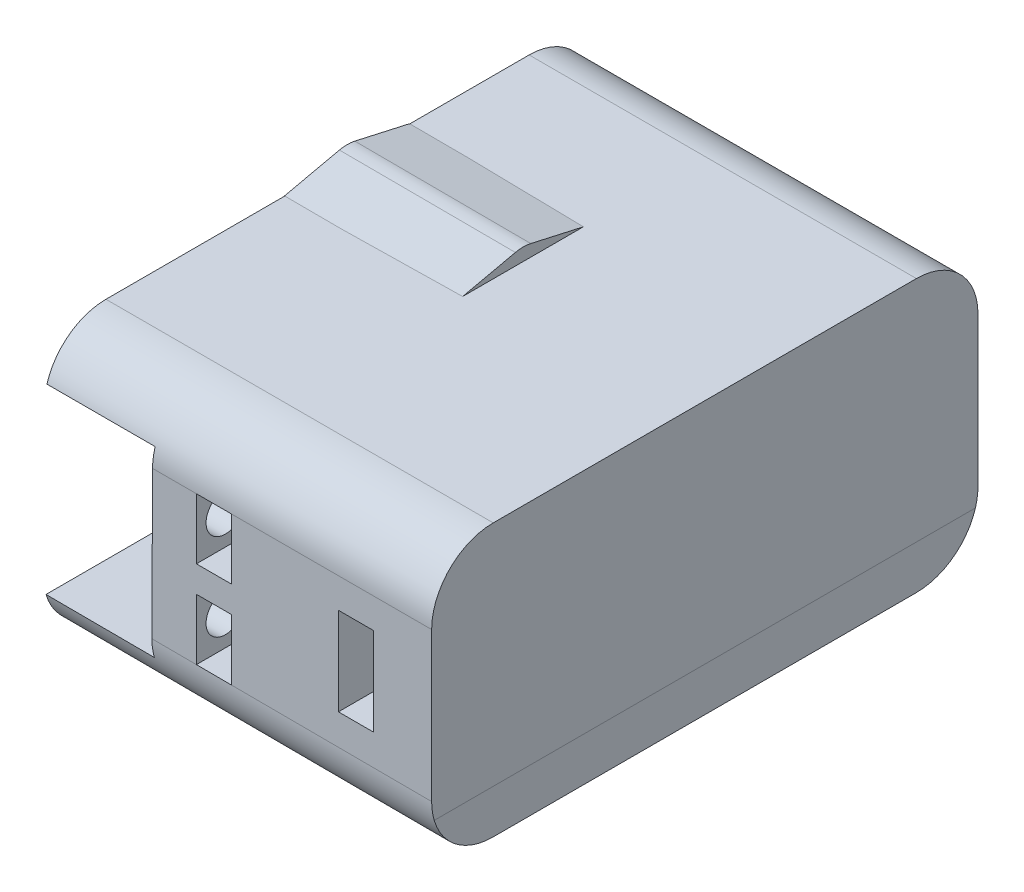
from build123d import *
from build123d.topology import SkipClean

# Parameters (mm, degrees)
BOSS_EXTRUDE1_DEPTH     = 8
BOSS_EXTRUDE2_REACH     = 29.616
SKETCH3_W               = 8
SKETCH3_H               = 20
BOSS_EXTRUDE3_DEPTH     = 6
SKETCH5_R               = 1.5
CUT_EXTRUDE1_DEPTH      = 30
CUT_EXTRUDE2_DEPTH      = 30
CUT_EXTRUDE2_DEPTH_BACK = 2.5
SKETCH6_R               = 1.872244448
SKETCH6_R_2             = 2.25
SKETCH6_R_3             = 2.800873709
SKETCH7_R               = 2.800873709
CUT_EXTRUDE3_DEPTH      = 32.5
BOSS_EXTRUDE4_DEPTH     = 0.45
BOSS_EXTRUDE5_REACH     = 34.303
SKETCH9_W               = 3.185015847
SKETCH9_H               = 14
SKETCH10_W              = 39.020325901
SKETCH10_H              = 14
BOSS_EXTRUDE6_DEPTH     = 0.45
BOSS_EXTRUDE7_DEPTH     = 5
BOSS_EXTRUDE8_REACH     = 71.397
SKETCH12_W              = 4.7
SKETCH12_H              = 62.1
BOSS_EXTRUDE10_REACH    = 73.051
BOSS_EXTRUDE12_REACH    = 73.051
SKETCH15_W              = 0.383636216
SKETCH15_H              = 14
SKETCH16_W              = 44.125949978
SKETCH16_H              = 62.1
BOSS_EXTRUDE13_DEPTH    = 5
FILLET1_R               = 7
SKETCH17_R              = 2.2
CUT_EXTRUDE8_DEPTH      = 20
CUT_EXTRUDE9_DEPTH      = 20
BOSS_EXTRUDE14_DEPTH    = 20
SKETCH20_R              = 1.7
CUT_EXTRUDE10_DEPTH     = 20
SKETCH21_W              = 4
SKETCH21_H              = 10
CUT_EXTRUDE11_DEPTH     = 11


with BuildPart() as part:
    # Sketch1 → Boss-Extrude1 (new body)
    with BuildSketch(Plane.XY):
        Polygon((-9.8, -9.9), (14.667227969, -10), (14.667227969, 10), (-9.8, 10), align=None)
    extrude(amount=BOSS_EXTRUDE1_DEPTH)

    # Boss-Extrude2: up to this plane
    boss_extrude2_end = Plane(origin=(-21.20832686, 0.146710491, 44.5), z_dir=(0.9999916479126735, -0.0040870655604918985, 1.0611945867115664e-14))
    # Sketch3 → Boss-Extrude2 (add, up to the surface)
    with BuildSketch(Plane.ZY.offset(9.8), mode=Mode.PRIVATE) as boss_extrude2_sk1:
        with Locations((4, 0)):
            Rectangle(SKETCH3_W, SKETCH3_H)
    boss_extrude2_tool1 = split(extrude(boss_extrude2_sk1.sketch, amount=BOSS_EXTRUDE2_REACH, mode=Mode.PRIVATE), bisect_by=boss_extrude2_end, keep=Keep.BOTH, mode=Mode.PRIVATE)
    add(boss_extrude2_tool1.solids().sort_by_distance((-9.8, 0, 4))[0])

    # Sketch4 → Boss-Extrude3 (add)
    with BuildSketch(Plane.XY.offset(8)):
        Polygon((14.667227969, 10), (-8.850453012, 10), (-8.850453012, -9.903880893), (14.667227969, -10), align=None)
    extrude(amount=BOSS_EXTRUDE3_DEPTH)

    # Sketch5 → Cut-Extrude1 (cut)
    with BuildSketch(Plane(origin=(0, 0, 0), x_dir=(-1, 0, 0), z_dir=(0, 0, -1))):
        with Locations((9.8, 7)):
            Circle(SKETCH5_R)
        with Locations((16.600765498, 0.199234502)):
            Circle(SKETCH5_R)
        with Locations((2.999234502, 0.199234502)):
            Circle(SKETCH5_R)
        with Locations((9.8, -6.601530997)):
            Circle(SKETCH5_R)
    extrude(amount=-CUT_EXTRUDE1_DEPTH, mode=Mode.SUBTRACT)

    # Sketch6 → Cut-Extrude2 (cut, two sides: drawn at the far end of the back side and taken through both)
    with BuildSketch(Plane.XY.offset(8).offset(-CUT_EXTRUDE2_DEPTH_BACK)):
        with Locations(Location((-9.8, -6.601530997, 0), (0, 0, 300.475535412))):
            Circle(SKETCH6_R)
        with Locations((-2.999234502, 0.199234502)):
            Circle(SKETCH6_R_2)
        with Locations(Location((-16.600765498, 0.199234502, 0), (0, 0, 180))):
            Circle(SKETCH6_R_2)
        with Locations(Location((-9.8, 7, 0), (0, 0, 65.037759798))):
            Circle(SKETCH6_R_2)
        with Locations(Location((-9.8, 0, 0), (0, 0, 289.81706499))):
            Circle(SKETCH6_R_3)
    extrude(amount=CUT_EXTRUDE2_DEPTH + CUT_EXTRUDE2_DEPTH_BACK, mode=Mode.SUBTRACT)

    # Sketch7 → Cut-Extrude3 (cut)
    with SkipClean():  # the faces are left unmerged after this step: merging them gives an invalid solid
        with BuildSketch(Plane.XY.offset(8)):
            with Locations(Location((-9.8, 0, 0), (0, 0, 180))):
                Circle(SKETCH7_R)
        extrude(amount=-CUT_EXTRUDE3_DEPTH, mode=Mode.SUBTRACT)
    add(part.part.scale(1), mode=Mode.REPLACE)  # the faces are merged on a copy

    # Sketch8 → Boss-Extrude4 (add)
    with BuildSketch(Plane(origin=(-0.040625311, -9.939887537, 0), x_dir=(-0.9999916479126736, 0.004087065560474376, 0), z_dir=(-0.004087065560474377, -0.9999916479126737, 0))):
        Polygon((21.208749342, -8), (21.208749342, -14), (-17.811250658, -14), (-17.811250658, 0), (21.208749342, 0), align=None)
    extrude(amount=BOSS_EXTRUDE4_DEPTH)

    # Boss-Extrude5: up to this face of the body (flat: up to its plane)
    boss_extrude5_end = Plane(part.part.faces().sort_by_distance((-1.218931766, 10, 6.308951595))[0])
    # Sketch9 → Boss-Extrude5 (add, up to the picked face)
    with BuildSketch(Plane(origin=(-0.040625311, -9.939887537, 0), x_dir=(0.9999916479126736, -0.004087065560474399, 0), z_dir=(0.0040870655604743995, 0.9999916479126737, 0)), mode=Mode.PRIVATE) as boss_extrude5_sk1:
        with Locations((16.218742735, -7)):
            Rectangle(SKETCH9_W, SKETCH9_H)
    boss_extrude5_tool1 = split(extrude(boss_extrude5_sk1.sketch, amount=BOSS_EXTRUDE5_REACH, mode=Mode.PRIVATE), bisect_by=boss_extrude5_end, keep=Keep.BOTH, mode=Mode.PRIVATE)
    add(boss_extrude5_tool1.solids().sort_by(Axis((16.177982, -10.006175, 7), (0.0040870655604743995, 0.9999916479126737, 0)))[0])

    # Sketch10 → Boss-Extrude6 (add)
    with BuildSketch(Plane(origin=(0, 10, 0), x_dir=(1, 0, 0), z_dir=(0, 1, 0))):
        with Locations((-1.657892534, -7)):
            Rectangle(SKETCH10_W, SKETCH10_H)
    extrude(amount=BOSS_EXTRUDE6_DEPTH)

    # Sketch11 → Boss-Extrude7 (add)
    with BuildSketch(Plane(origin=(0, 10.45, 0), x_dir=(1, 0, 0), z_dir=(0, 1, 0))):
        Polygon((-21.168055484, 0), (17.852270417, 0), (22.852270417, 0), (22.852270417, -55.1), (22.852270417, -62.1), (17.750476753, -62.1), (-21.168055484, -62.1), align=None)
    extrude(amount=BOSS_EXTRUDE7_DEPTH)

    # Boss-Extrude8: up to this plane
    boss_extrude8_end = Plane(origin=(-0.042464491, -10.389883779, 0), z_dir=(0.004087065560474399, 0.9999916479126736, 0))
    # Sketch12 → Boss-Extrude8 (add, up to the surface)
    with BuildSketch(Plane(origin=(0, 10.45, 0), x_dir=(-1, 0, 0), z_dir=(0, -1, 0)), mode=Mode.PRIVATE) as boss_extrude8_sk1:
        with Locations((-20.502270417, -31.05)):
            Rectangle(SKETCH12_W, SKETCH12_H)
    boss_extrude8_tool1 = split(extrude(boss_extrude8_sk1.sketch, amount=BOSS_EXTRUDE8_REACH, mode=Mode.PRIVATE), bisect_by=boss_extrude8_end, keep=Keep.BOTH, mode=Mode.PRIVATE)
    add(boss_extrude8_tool1.solids().sort_by_distance((20.50227, 10.45, 31.05))[0])

    # Boss-Extrude10: up to this plane
    boss_extrude10_end = Plane(origin=(0, 10.45, 0), z_dir=(0, -1, 0))
    # Sketch13 → Boss-Extrude10 (add, up to the surface)
    with BuildSketch(Plane(origin=(-0.042464491, -10.389883779, 0), x_dir=(-0.9999916479126736, 0.004087065560474399, 0), z_dir=(-0.0040870655604743995, -0.9999916479126737, 0)), mode=Mode.PRIVATE) as boss_extrude10_sk1:
        Polygon((8.908749342, -61.4), (8.908749342, -62.1), (-17.791250658, -62.1), (-18.194886874, -62.1), (-18.194886874, -55.657746708), (-17.791250658, -55.657746708), (8.908749342, -55.657746708), align=None)
    boss_extrude10_tool1 = split(extrude(boss_extrude10_sk1.sketch, amount=-BOSS_EXTRUDE10_REACH, mode=Mode.PRIVATE), bisect_by=boss_extrude10_end, keep=Keep.BOTH, mode=Mode.PRIVATE)
    add(boss_extrude10_tool1.solids().sort_by_distance((4.600565, -10.40886, 58.878873))[0])

    # Boss-Extrude12: up to this plane
    boss_extrude12_end = Plane(origin=(0, 10.45, 0), z_dir=(0, -1, 0))
    # Sketch15 → Boss-Extrude12 (add, up to the surface)
    with BuildSketch(Plane(origin=(-0.042464491, -10.389883779, 0), x_dir=(0.9999916479126736, -0.004087065560474399, 0), z_dir=(-0.0040870655604743995, -0.9999916479126737, 0)), mode=Mode.PRIVATE) as boss_extrude12_sk1:
        with Locations((18.003068766, 7)):
            Rectangle(SKETCH15_W, SKETCH15_H)
    boss_extrude12_tool1 = split(extrude(boss_extrude12_sk1.sketch, amount=-BOSS_EXTRUDE12_REACH, mode=Mode.PRIVATE), bisect_by=boss_extrude12_end, keep=Keep.BOTH, mode=Mode.PRIVATE)
    add(boss_extrude12_tool1.solids().sort_by_distance((17.960454, -10.463464, 7))[0])

    # Sketch16 → Boss-Extrude13 (add)
    with BuildSketch(Plane(origin=(-0.042464491, -10.389883779, 0), x_dir=(-0.9999916479126736, 0.004087065560474399, 0), z_dir=(-0.0040870655604743995, -0.9999916479126737, 0))):
        with Locations((-0.83195114, -31.05)):
            Rectangle(SKETCH16_W, SKETCH16_H)
    extrude(amount=BOSS_EXTRUDE13_DEPTH)

    # Fillet1
    # the kernel refuses this fillet: 7 mm, written as the material it takes off along each edge
    with BuildSketch(Plane(origin=(40.352270417, 15.45, 62.1), x_dir=(0, 0, -1), z_dir=(-1, 0, 0))) as fillet1_piece_1:
        with BuildLine():
            CenterArc((FILLET1_R, FILLET1_R), FILLET1_R, 180, 90)
            Line((0, FILLET1_R), (0, 0))
            Line((0, 0), (FILLET1_R, 0))
        make_face()
    extrude(amount=79.020325901, mode=Mode.SUBTRACT)
    with BuildSketch(Plane(origin=(-38.793600183, -15.231545785, 62.1), x_dir=(0.004087065560474399, 0.9999916479126735, 0), z_dir=(0.9999916479126737, -0.0040870655604743995, 0)), Plane(origin=(40.331688928, -15.55493873, 0), x_dir=(0.004087065560474399, 0.9999916479126735, 0), z_dir=(-0.9999916479126737, 0.0040870655604743995, 0))) as fillet1_piece_2:
        with BuildLine():
            CenterArc((FILLET1_R, -FILLET1_R), FILLET1_R, 90, 90)
            Line((0, -FILLET1_R), (0, 0))
            Line((0, 0), (FILLET1_R, 0))
        make_face()
    extrude(amount=79.125949978, mode=Mode.SUBTRACT)
    with BuildSketch(Plane(origin=(-38.668055484, 15.45, 0), x_dir=(0, -1, 0), z_dir=(1, 0, 0))) as fillet1_piece_3:
        with BuildLine():
            CenterArc((FILLET1_R, -FILLET1_R), FILLET1_R, 90, 90)
            Line((0, -FILLET1_R), (0, 0))
            Line((0, 0), (FILLET1_R, 0))
        make_face()
    extrude(amount=79.020325901, mode=Mode.SUBTRACT)

    # Sketch17 → Cut-Extrude8 (cut)
    with BuildSketch(Plane(origin=(-8.908674935, 0.036410643, 0), x_dir=(0, 0, 1), z_dir=(-0.9999916479126737, 0.0040870655604744, -8.326704424266156e-13))):
        with Locations(Location((58.8, -4.889970557, 0), (0, 0, 270))):
            Circle(SKETCH17_R)
        with Locations(Location((58.8, 5.010029443, 0), (0, 0, 270))):
            Circle(SKETCH17_R)
    extrude(amount=-CUT_EXTRUDE8_DEPTH, mode=Mode.SUBTRACT)

    # Sketch18 → Cut-Extrude9 (cut)
    with BuildSketch(Plane.XY.offset(62.1)):
        Polygon((-3.888198616, -4.949888082), (-3.888198616, -8.374149176), (0.111801384, -8.390497575), (0.111801384, -1.449888082), (-3.888198616, -1.449888082), align=None)
        Polygon((-3.888198616, 8.45), (-3.888198616, 5.046398242), (-3.888198616, 1.546398242), (0.111801384, 1.546398242), (0.111801384, 8.45), align=None)
    extrude(amount=-CUT_EXTRUDE9_DEPTH, mode=Mode.SUBTRACT)

    # Sketch19 → Boss-Extrude14 (add)
    with BuildSketch(Plane(origin=(-21.230846526, 0.086772586, 0), x_dir=(0, 0, 1), z_dir=(-0.9999916479126737, 0.0040870655604743995, 0))):
        with BuildLine():
            Line((34.799540996, -15.389970557), (27.692259446, -15.389970557))
            Line((27.692259446, -15.389970557), (20.584977895, -15.389970557))
            Line((20.584977895, -15.389970557), (26.815853016, -16.790117538))
            ThreePointArc((26.815853016, -16.790117538), (27.692259446, -16.887374052), (28.568665876, -16.790117538))
            Line((28.568665876, -16.790117538), (34.799540996, -15.389970557))
        make_face()
        with BuildLine():
            ThreePointArc((26.815853016, 16.790117538), (27.692259446, 16.887374052), (28.568665876, 16.790117538))
            Line((28.568665876, 16.790117538), (34.799540996, 15.389970557))
            Line((34.799540996, 15.389970557), (20.584977895, 15.389970557))
            Line((20.584977895, 15.389970557), (26.815853016, 16.790117538))
        make_face()
    extrude(amount=-BOSS_EXTRUDE14_DEPTH)

    # Sketch20 → Cut-Extrude10 (cut)
    with BuildSketch(Plane(origin=(-21.230846526, 0.086772586, 0), x_dir=(0, 0, 1), z_dir=(-0.9999916479126737, 0.0040870655604743995, 0))):
        with Locations(Location((27.692259446, -12.889970557, 0), (0, 0, 270))):
            Circle(SKETCH20_R)
        with Locations(Location((27.692259446, 12.889970557, 0), (0, 0, 270))):
            Circle(SKETCH20_R)
    extrude(amount=-CUT_EXTRUDE10_DEPTH, mode=Mode.SUBTRACT)

    # Sketch21 → Cut-Extrude11 (cut)
    with BuildSketch(Plane.XY.offset(62.1)):
        with Locations((14.253029049, 0.04825508)):
            Rectangle(SKETCH21_W, SKETCH21_H)
    extrude(amount=-CUT_EXTRUDE11_DEPTH, mode=Mode.SUBTRACT)


solid = part.part
